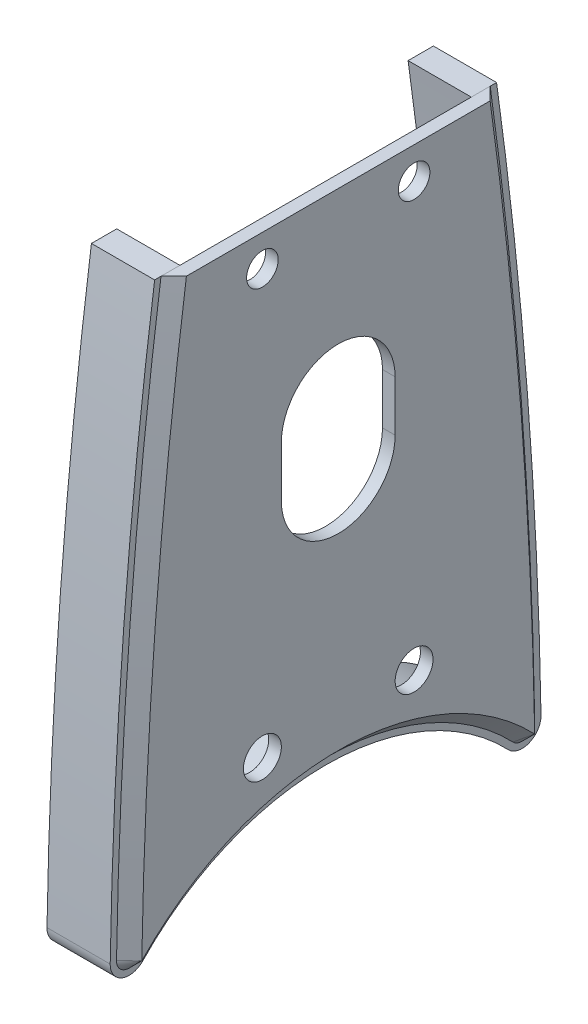
from build123d import *

# Parameters (mm, degrees)
SKETCH1_R           = 2.5
BOSS_EXTRUDE1_DEPTH = 2
CUT_EXTRUDE1_DEPTH  = 2
BOSS_EXTRUDE3_DEPTH = 10
SKETCH5_R           = 3
CUT_EXTRUDE2_DEPTH  = 10
CHAMFER4_SIZE       = 3


with BuildPart() as part:
    # Sketch1 → Boss-Extrude1 (new body)
    with BuildSketch(Plane(origin=(0, 0, 0), x_dir=(0, 0, -1), z_dir=(1, 0, 0))):
        with BuildLine():
            Line((-27.052882521, 120), (27.052882521, 120))
            ThreePointArc((27.052882521, 120), (31.930110278, 74.988584163), (34.08250741, 29.764894653))
            ThreePointArc((34.08250741, 29.764894653), (32.223851782, 26.938192137), (28.914381406, 27.63980007))
            ThreePointArc((28.914381406, 27.63980007), (0, 40), (-28.914381406, 27.63980007))
            ThreePointArc((-28.914381406, 27.63980007), (-32.223851782, 26.938192137), (-34.08250741, 29.764894653))
            ThreePointArc((-34.08250741, 29.764894653), (-31.930110278, 74.988584163), (-27.052882521, 120))
        make_face()
        with Locations((-12, 115)):
            Circle(SKETCH1_R, mode=Mode.SUBTRACT)
        with Locations((12, 115)):
            Circle(SKETCH1_R, mode=Mode.SUBTRACT)
    extrude(amount=BOSS_EXTRUDE1_DEPTH)

    # Sketch2 → Cut-Extrude1 (cut)
    with BuildSketch(Plane.ZY):
        with BuildLine():
            Line((9, 89.7), (9, 81.7))
            ThreePointArc((9, 81.7), (0, 72.7), (-9, 81.7))
            Line((-9, 81.7), (-9, 89.7))
            ThreePointArc((-9, 89.7), (0, 98.7), (9, 89.7))
        make_face()
    extrude(amount=-CUT_EXTRUDE1_DEPTH, mode=Mode.SUBTRACT)

    # Sketch5 → Cut-Extrude2 (cut)
    with BuildSketch(Plane(origin=(2, 0, 0), x_dir=(0, 0, -1), z_dir=(1, 0, 0))):
        with Locations((-12, 48)):
            Circle(SKETCH5_R)
        with Locations((12, 48)):
            Circle(SKETCH5_R)
    extrude(amount=-CUT_EXTRUDE2_DEPTH, mode=Mode.SUBTRACT)

    # Chamfer4
    # the kernel refuses this chamfer: 3 mm, written as the material it takes off along each edge
    with BuildSketch(Plane(origin=(2, 16.7375, 715.804342047), x_dir=(0, 0.14786465744034102, -0.9890076051679535), z_dir=(0, 0.9890076051679535, 0.14786465744034102))) as chamfer4_piece_1:
        Polygon((750, CHAMFER4_SIZE), (750 - CHAMFER4_SIZE, 0), (750, 0), align=None)
    revolve(axis=Axis((2, 16.7375, 715.804342047), (-1, 0, 0)), revolution_arc=7.507930855, mode=Mode.SUBTRACT)
    with BuildSketch(Plane(origin=(2, 29.712785075, -31.082960012), x_dir=(0, 0.01736985953789309, -0.9998491326093322), z_dir=(0, 0.9998491326093322, 0.01736985953789309))) as chamfer4_piece_2:
        Polygon((3 - CHAMFER4_SIZE, 0), (3, CHAMFER4_SIZE), (3, 0), align=None)
    revolve(axis=Axis((2, 29.712785075, -31.082960012), (-1, 0, 0)), revolution_arc=137.286346121, mode=Mode.SUBTRACT)
    with BuildSketch(Plane(origin=(2, 0, 0), x_dir=(0, 0.6909950017388863, -0.7228595351601006), z_dir=(0, -0.7228595351601006, -0.6909950017388863))) as chamfer4_piece_3:
        Polygon((40 + CHAMFER4_SIZE, 0), (40, -CHAMFER4_SIZE), (40, 0), align=None)
    revolve(axis=Axis((2, 0, 0), (1, 0, 0)), revolution_arc=92.582152855, mode=Mode.SUBTRACT)
    with BuildSketch(Plane(origin=(2, 29.712785075, 31.082960012), x_dir=(0, -0.6909950017388667, -0.7228595351601192), z_dir=(0, 0.7228595351601192, -0.6909950017388667))) as chamfer4_piece_4:
        Polygon((3 - CHAMFER4_SIZE, 0), (3, CHAMFER4_SIZE), (3, 0), align=None)
    revolve(axis=Axis((2, 29.712785075, 31.082960012), (-1, 0, 0)), revolution_arc=137.286346121, mode=Mode.SUBTRACT)
    with BuildSketch(Plane(origin=(2, 16.7375, -715.804342047), x_dir=(0, 0.017369859537853687, 0.9998491326093328), z_dir=(0, -0.9998491326093328, 0.017369859537853687))) as chamfer4_piece_5:
        Polygon((750, CHAMFER4_SIZE), (750 - CHAMFER4_SIZE, 0), (750, 0), align=None)
    revolve(axis=Axis((2, 16.7375, -715.804342047), (-1, 0, 0)), revolution_arc=7.507930855, mode=Mode.SUBTRACT)


with BuildPart() as body_2:
    # Sketch4 → Boss-Extrude3 (new body)
    with BuildSketch(Plane.ZY):
        with BuildLine():
            Line((-27.052882521, 120), (-23.052882521, 120))
            ThreePointArc((-23.052882521, 120), (-27.572077693, 79.415145268), (-29.875645827, 38.644480171))
            ThreePointArc((-29.875645827, 38.644480171), (-28.303672095, 35.917838187), (-25.161377416, 36.095776575))
            ThreePointArc((-25.161377416, 36.095776575), (0, 44), (25.161377416, 36.095776575))
            ThreePointArc((25.161377416, 36.095776575), (28.303672095, 35.917838187), (29.875645827, 38.644480171))
            ThreePointArc((29.875645827, 38.644480171), (27.572077693, 79.415145268), (23.052882521, 120))
            Line((23.052882521, 120), (27.052882521, 120))
            ThreePointArc((27.052882521, 120), (31.930110278, 74.988584163), (34.08250741, 29.764894653))
            ThreePointArc((34.08250741, 29.764894653), (32.223851782, 26.938192137), (28.914381406, 27.63980007))
            ThreePointArc((28.914381406, 27.63980007), (0, 40), (-28.914381406, 27.63980007))
            ThreePointArc((-28.914381406, 27.63980007), (-32.223851782, 26.938192137), (-34.08250741, 29.764894653))
            ThreePointArc((-34.08250741, 29.764894653), (-31.930110278, 74.988584163), (-27.052882521, 120))
        make_face()
    extrude(amount=BOSS_EXTRUDE3_DEPTH)


solid = Compound([part.part, body_2.part])
